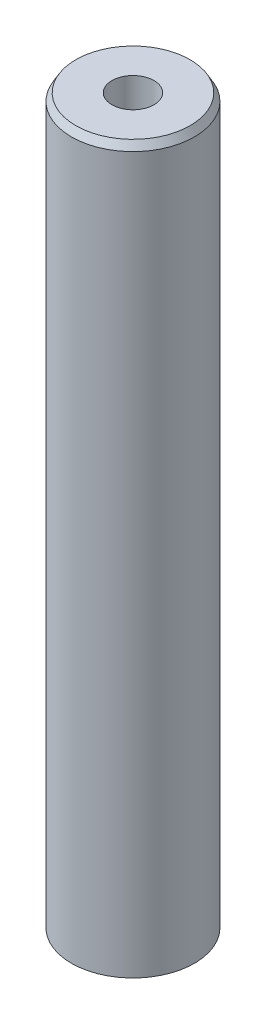
from build123d import *
from OCP.BRepFilletAPI import BRepFilletAPI_MakeChamfer

# Parameters (mm, degrees)
SKETCH1_R           = 25
BOSS_EXTRUDE1_DEPTH = 295.627133698
SKETCH2_R           = 8.539333823
CUT_EXTRUDE1_DEPTH  = 298.733777355
CHAMFER1_SIZE       = 3.074292057
CHAMFER1_SIZE2      = 1.774943346


with BuildPart() as part:
    # Sketch1 → Boss-Extrude1 (new body)
    with BuildSketch(Plane(origin=(0, 0, 0), x_dir=(1, 0, 0), z_dir=(0, 1, 0))):
        Circle(SKETCH1_R)
    extrude(amount=BOSS_EXTRUDE1_DEPTH)

    # Sketch2 → Cut-Extrude1 (cut, through all)
    with BuildSketch(Plane(origin=(0, 0, 0), x_dir=(1, 0, 0), z_dir=(0, 1, 0))):
        Circle(SKETCH2_R)
    extrude(amount=CUT_EXTRUDE1_DEPTH, mode=Mode.SUBTRACT)

    # Chamfer1: one chamfer whose edges measure the first distance from different faces: ONE call of the kernel's chamfer builder (chamfer() names one face for all edges)
    chamfer1_edges_1 = [part.edges().sort_by_distance(p)[0] for p in [
        (-25, 295.627133698, 0),
    ]]
    chamfer1_side_1 = [part.faces().sort_by_distance(p)[0] for p in [
        (-25, 147.813566849, 0),
    ]]
    chamfer1_edges_2 = [part.edges().sort_by_distance(p)[0] for p in [
        (-25, 0, 0),
    ]]
    chamfer1_side_2 = [part.faces().sort_by_distance(p)[0] for p in [
        (-24.292893219, 0, 0),
    ]]
    chamfer1 = BRepFilletAPI_MakeChamfer(part.part.solid().wrapped)
    for e in chamfer1_edges_1:
        chamfer1.Add(CHAMFER1_SIZE, CHAMFER1_SIZE2, e.wrapped, chamfer1_side_1[0].wrapped)  # the first distance lies on this face
    for e in chamfer1_edges_2:
        chamfer1.Add(CHAMFER1_SIZE, CHAMFER1_SIZE2, e.wrapped, chamfer1_side_2[0].wrapped)  # the first distance lies on this face
    add(Compound.cast(chamfer1.Shape()), mode=Mode.REPLACE)


solid = part.part
